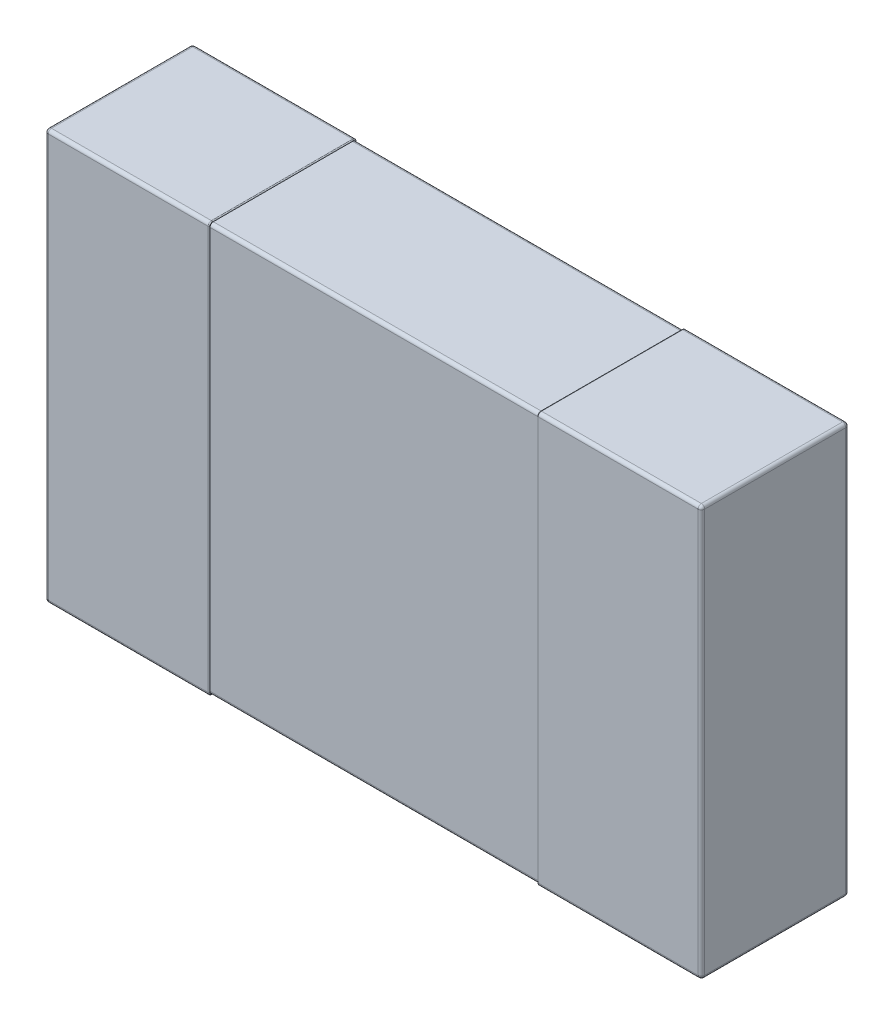
from build123d import *

# Parameters (mm, degrees)
SKETCH1_W                           = 2
SKETCH1_H                           = 1.25
ALL_BODY_DEPTH                      = 0.45
CUT_OUT_THE_BODY_FOR_PIN_DEPTH      = 0.5
CUT_OUT_THE_BODY_FOR_PIN_DEPTH_BACK = 0.5
SKETCH2_OUTSIDE_W                   = 2.93
SKETCH2_OUTSIDE_H                   = 3.73
SKETCH2_OUTSIDE_W_2                 = 0.444
SKETCH2_OUTSIDE_H_2                 = 1.244
BODY_FILLET_R                       = 0.01
PIN_FILLET_A_R                      = 0.01
PIN_FILLET_B_R                      = 0.003


with BuildPart() as part:
    # Sketch1 → All body (new body)
    with BuildSketch(Plane.XY):
        Rectangle(SKETCH1_W, SKETCH1_H)
    extrude(amount=ALL_BODY_DEPTH)

    # Sketch2 outside → Cut out the body for pin (cut, two sides: drawn at the far end of the back side and taken through both)
    with BuildSketch(Plane(origin=(0, 0, 0), x_dir=(0, 0, -1), z_dir=(1, 0, 0)).offset(-CUT_OUT_THE_BODY_FOR_PIN_DEPTH_BACK)):
        with Locations((-0.225, 0)):
            Rectangle(SKETCH2_OUTSIDE_W, SKETCH2_OUTSIDE_H)
        with Locations((-0.225, 0)):
            Rectangle(SKETCH2_OUTSIDE_W_2, SKETCH2_OUTSIDE_H_2, mode=Mode.SUBTRACT)
    extrude(amount=CUT_OUT_THE_BODY_FOR_PIN_DEPTH + CUT_OUT_THE_BODY_FOR_PIN_DEPTH_BACK, mode=Mode.SUBTRACT)

    # Body fillet
    body_fillet_edges = [part.edges().sort_by_distance(p)[0] for p in [
        (0, 0.622, 0.003),
        (0, 0.622, 0.447),
        (0, -0.622, 0.447),
        (0, -0.622, 0.003),
    ]]
    fillet(body_fillet_edges, radius=BODY_FILLET_R)

    # Pin fillet a
    pin_fillet_a_edges = [part.edges().sort_by_distance(p)[0] for p in [
        (1, 0, 0.45),
        (-0.75, 0.625, 0),
        (0.75, -0.625, 0),
        (0.75, -0.625, 0.45),
        (-0.75, 0.625, 0.45),
        (0.75, 0.625, 0.45),
        (-1, 0, 0.45),
        (0.75, 0.625, 0),
        (1, 0, 0),
        (-0.75, -0.625, 0),
        (-1, 0, 0),
        (-1, 0.625, 0.225),
        (1, 0.625, 0.225),
        (1, -0.625, 0.225),
        (-1, -0.625, 0.225),
        (-0.75, -0.625, 0.45),
    ]]
    fillet(pin_fillet_a_edges, radius=PIN_FILLET_A_R)

    # Pin fillet b
    pin_fillet_b_edges = [part.edges().sort_by_distance(p)[0] for p in [
        (0.5, -0.625, 0.225),
        (0.5, 0, 0.45),
        (0.5, 0.625, 0.225),
        (0.5, 0, 0),
        (-0.5, 0.625, 0.225),
        (-0.5, 0, 0.45),
        (-0.5, -0.625, 0.225),
        (-0.5, 0, 0),
        (0.5, 0.622071068, 0.002928932),
        (0.5, -0.622071068, 0.002928932),
        (0.5, -0.622071068, 0.447071068),
        (0.5, 0.622071068, 0.447071068),
        (-0.5, -0.622071068, 0.447071068),
        (-0.5, 0.622071068, 0.447071068),
        (-0.5, -0.622071068, 0.002928932),
        (-0.5, 0.622071068, 0.002928932),
    ]]
    fillet(pin_fillet_b_edges, radius=PIN_FILLET_B_R - 0.0001)  # a hair under: the kernel refuses the full size


solid = part.part
